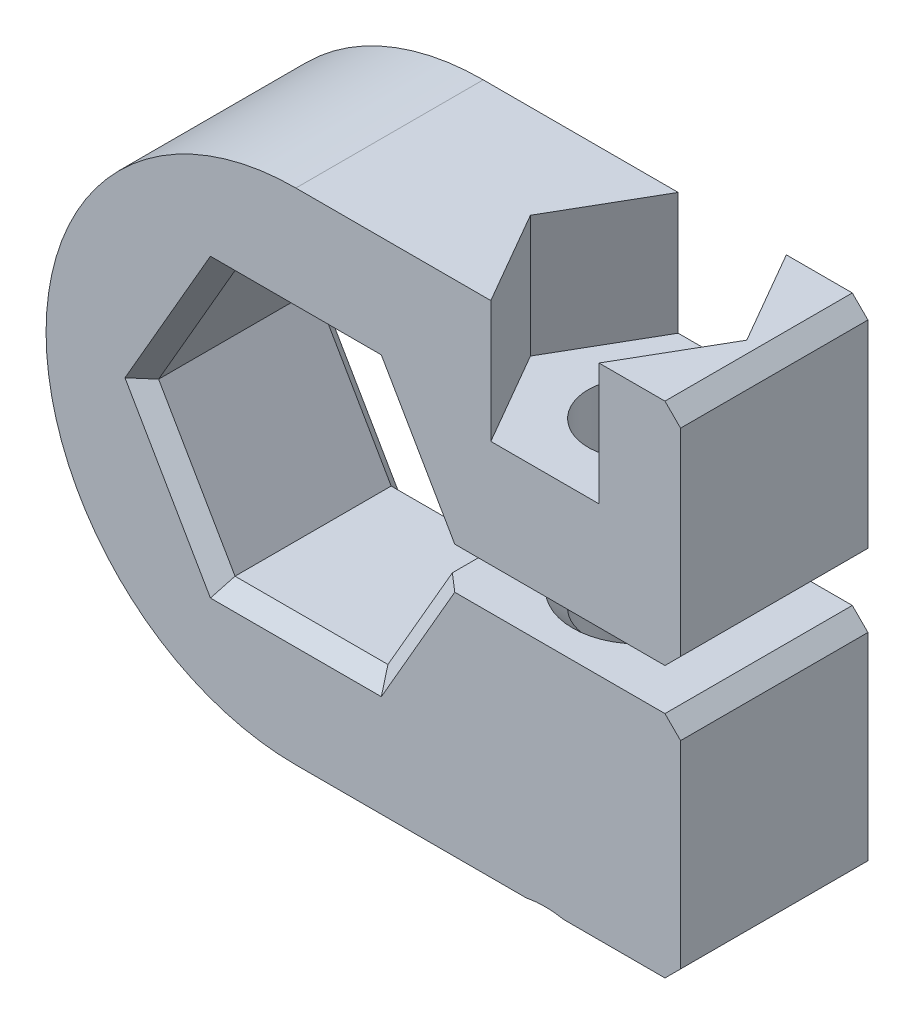
from build123d import *

# Parameters (mm, degrees)
BOSS_EXTRUDE1_DEPTH = 9.525
CHAMFER1_SIZE       = 0.79375
SKETCH3_R           = 2.5527
CUT_EXTRUDE1_DEPTH  = 34.442502732
CUT_EXTRUDE2_DEPTH  = 6.2
SKETCH5_R           = 4.064
CUT_EXTRUDE3_DEPTH  = 6.35
CHAFL_N1_SIZE       = 0.79375


with BuildPart() as part:
    # Sketch2 → Boss-Extrude1 (new body)
    with BuildSketch(Plane.XY):
        with BuildLine():
            Line((3.886144662, -6.731), (7.161260289, -1.058333333))
            Line((7.161260289, -1.058333333), (9.779, -1.058333333))
            Line((9.779, -1.058333333), (19.558, -1.058333333))
            Line((19.558, -1.058333333), (19.558, -12.7))
            Line((19.558, -12.7), (0, -12.7))
            ThreePointArc((0, -12.7), (-12.7, 0), (0, 12.7))
            Line((0, 12.7), (19.558, 12.7))
            Line((19.558, 12.7), (19.558, 1.058333333))
            Line((19.558, 1.058333333), (9.779, 1.058333333))
            Line((9.779, 1.058333333), (7.161260289, 1.058333333))
            Line((7.161260289, 1.058333333), (3.886144662, 6.731))
            Line((3.886144662, 6.731), (-3.886144662, 6.731))
            Line((-3.886144662, 6.731), (-7.772289324, 0))
            Line((-7.772289324, 0), (-3.886144662, -6.731))
            Line((-3.886144662, -6.731), (3.886144662, -6.731))
        make_face()
    extrude(amount=BOSS_EXTRUDE1_DEPTH)

    # Chamfer1
    chamfer1_edges = [part.edges().sort_by_distance(p)[0] for p in [
        (5.523702475, 3.894666667, 0),
        (0, 6.731, 0),
        (-5.829216993, 3.3655, 0),
        (-5.829216993, -3.3655, 0),
        (0, -6.731, 0),
        (5.523702475, -3.894666667, 0),
        (19.558, -1.058333333, 4.7625),
        (19.558, -12.7, 4.7625),
        (19.558, 12.7, 4.7625),
        (19.558, 1.058333333, 4.7625),
        (5.523702475, -3.894666667, 9.525),
        (0, -6.731, 9.525),
        (-5.829216993, -3.3655, 9.525),
        (-5.829216993, 3.3655, 9.525),
        (0, 6.731, 9.525),
        (5.523702475, 3.894666667, 9.525),
    ]]
    chamfer(chamfer1_edges, length=CHAMFER1_SIZE)

    # Sketch3 → Cut-Extrude1 (cut, through all)
    with BuildSketch(Plane(origin=(0, 12.7, 0), x_dir=(1, 0, 0), z_dir=(0, 1, 0))):
        with Locations(Location((12.660521603, -4.7625, 0), (0, 0, 180))):
            Circle(SKETCH3_R)
    extrude(amount=-CUT_EXTRUDE1_DEPTH, mode=Mode.SUBTRACT)

    # Sketch4 → Cut-Extrude2 (cut)
    with BuildSketch(Plane(origin=(0, 12.7, 0), x_dir=(1, 0, 0), z_dir=(0, 1, 0))):
        Polygon((9.910890946, -9.525), (15.41015226, -9.525), (18.159782917, -4.7625), (15.41015226, 0), (9.910890946, 0), (7.161260289, -4.7625), align=None)
    extrude(amount=-CUT_EXTRUDE2_DEPTH, mode=Mode.SUBTRACT)

    # Sketch5 → Cut-Extrude3 (cut)
    with BuildSketch(Plane.XZ.offset(12.7)):
        with Locations((12.660521603, 4.7625)):
            Circle(SKETCH5_R)
    extrude(amount=-CUT_EXTRUDE3_DEPTH, mode=Mode.SUBTRACT)

    # Chaflán1
    # the kernel refuses this chamfer: 0.79375 mm, written as the material it takes off along each edge
    with BuildSketch(Plane(origin=(12.660521603, -1.058333333, 4.7625), x_dir=(-1, 0, 0), z_dir=(0, 0, -1))) as chafl_n1_piece_1:
        Polygon((2.5527 + CHAFL_N1_SIZE, 0), (2.5527, -CHAFL_N1_SIZE), (2.5527, 0), align=None)
    revolve(axis=Axis((12.660521603, -1.058333333, 4.7625), (0, 1, 0)), mode=Mode.SUBTRACT)
    with BuildSketch(Plane(origin=(12.660521603, 1.058333333, 4.7625), x_dir=(-1, 0, 0), z_dir=(0, 0, -1))) as chafl_n1_piece_2:
        Polygon((2.5527 + CHAFL_N1_SIZE, 0), (2.5527, CHAFL_N1_SIZE), (2.5527, 0), align=None)
    revolve(axis=Axis((12.660521603, 1.058333333, 4.7625), (0, 1, 0)), mode=Mode.SUBTRACT)
    with BuildSketch(Plane(origin=(12.660521603, -12.7, 4.7625), x_dir=(1, 0, 0), z_dir=(0, 0, -1))) as chafl_n1_piece_3:
        Polygon((4.064 + CHAFL_N1_SIZE, 0), (4.064, -CHAFL_N1_SIZE), (4.064, 0), align=None)
    revolve(axis=Axis((12.660521603, -12.7, 4.7625), (0, -1, 0)), mode=Mode.SUBTRACT)


solid = part.part
